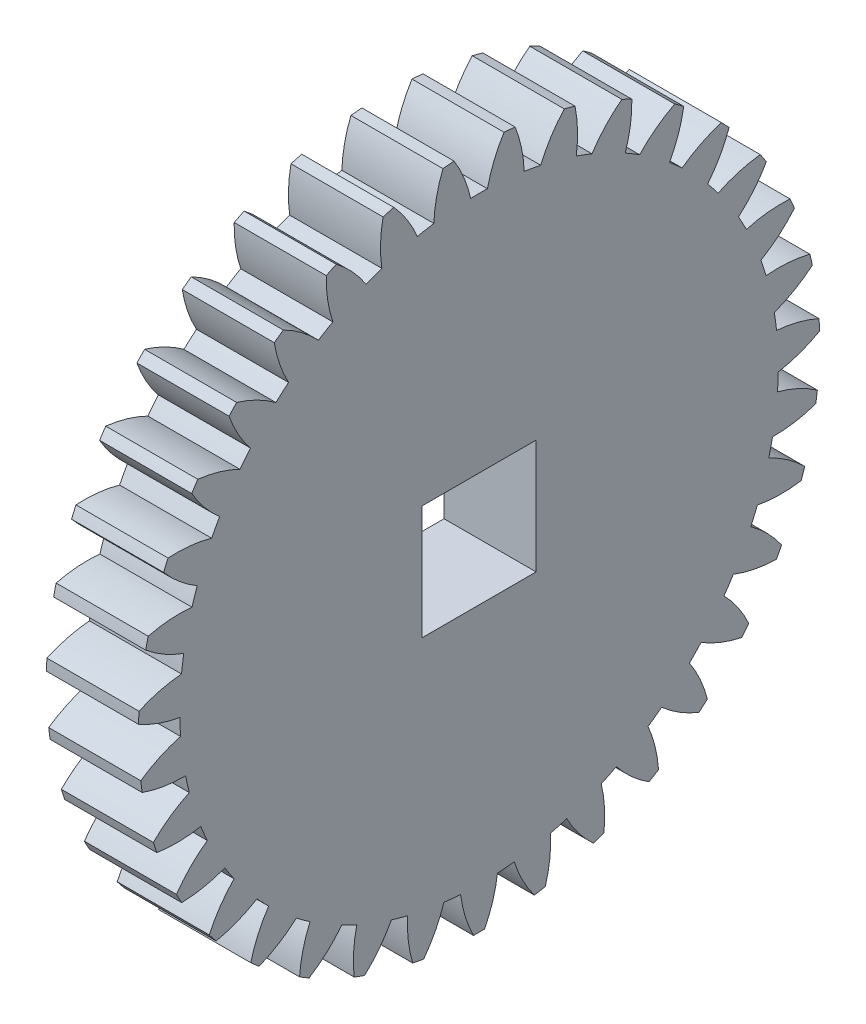
from build123d import *

# Parameters (mm, degrees)
BASPROSKE_W        = 5
BASPROSKE_H        = 18.5
TOOTHCUT_DEPTH     = 27.636441204
TEETHCUTS_COUNT    = 35
TEETHCUTS_ANGLE    = 349.714285714
BORSKE_R           = 1.5
BORE_DEPTH         = 50.0000508
SKETCH1_W          = 6.2
SKETCH1_H          = 6.2
CUT_EXTRUDE1_DEPTH = 10


with BuildPart() as part:
    # BasProSke → Base-Revolve (revolve)
    with BuildSketch(Plane(origin=(0, 0, 0), x_dir=(1, 0, 0), z_dir=(0, 1, 0))):
        with Locations((2.5, 9.25)):
            Rectangle(BASPROSKE_W, BASPROSKE_H)
    revolve(axis=Axis((-10, 0, 0), (1, 0, 0)))

    # TooCutSke → ToothCut (cut, through all)
    with BuildSketch(Plane(origin=(0, 0, 0), x_dir=(0, 0, -1), z_dir=(1, 0, 0))):
        with BuildLine():
            ThreePointArc((0.456361119, 16.242590173), (0, 16.249), (-0.456361119, 16.242590173))
            ThreePointArc((-0.456361119, 16.242590173), (-0.817781123, 17.39831105), (-1.372969849, 18.474452602))
            ThreePointArc((-1.372969849, 18.474452602), (0, 18.5254), (1.372969849, 18.474452602))
            ThreePointArc((1.372969849, 18.474452602), (0.817781123, 17.39831105), (0.456361119, 16.242590173))
        make_face()
    toothcut = extrude(amount=TOOTHCUT_DEPTH, mode=Mode.SUBTRACT)

    # TeethCuts: ToothCut ×35 about axis
    teethcuts_axis = Axis((-10, 0, 0), (1, 0, 0))
    for i in range(1, TEETHCUTS_COUNT):
        add(toothcut.rotate(teethcuts_axis, i * TEETHCUTS_ANGLE / (TEETHCUTS_COUNT - 1)), mode=Mode.SUBTRACT)

    # BorSke → Bore (cut, symmetric)
    with BuildSketch(Plane(origin=(0, 0, 0), x_dir=(0, 0, -1), z_dir=(1, 0, 0))):
        Circle(BORSKE_R)
    extrude(amount=BORE_DEPTH, both=True, mode=Mode.SUBTRACT)

    # Sketch1 → Cut-Extrude1 (cut)
    with BuildSketch(Plane(origin=(5, 0, 0), x_dir=(0, 0, -1), z_dir=(1, 0, 0))):
        Rectangle(SKETCH1_W, SKETCH1_H)
    extrude(amount=-CUT_EXTRUDE1_DEPTH, mode=Mode.SUBTRACT)


solid = part.part
